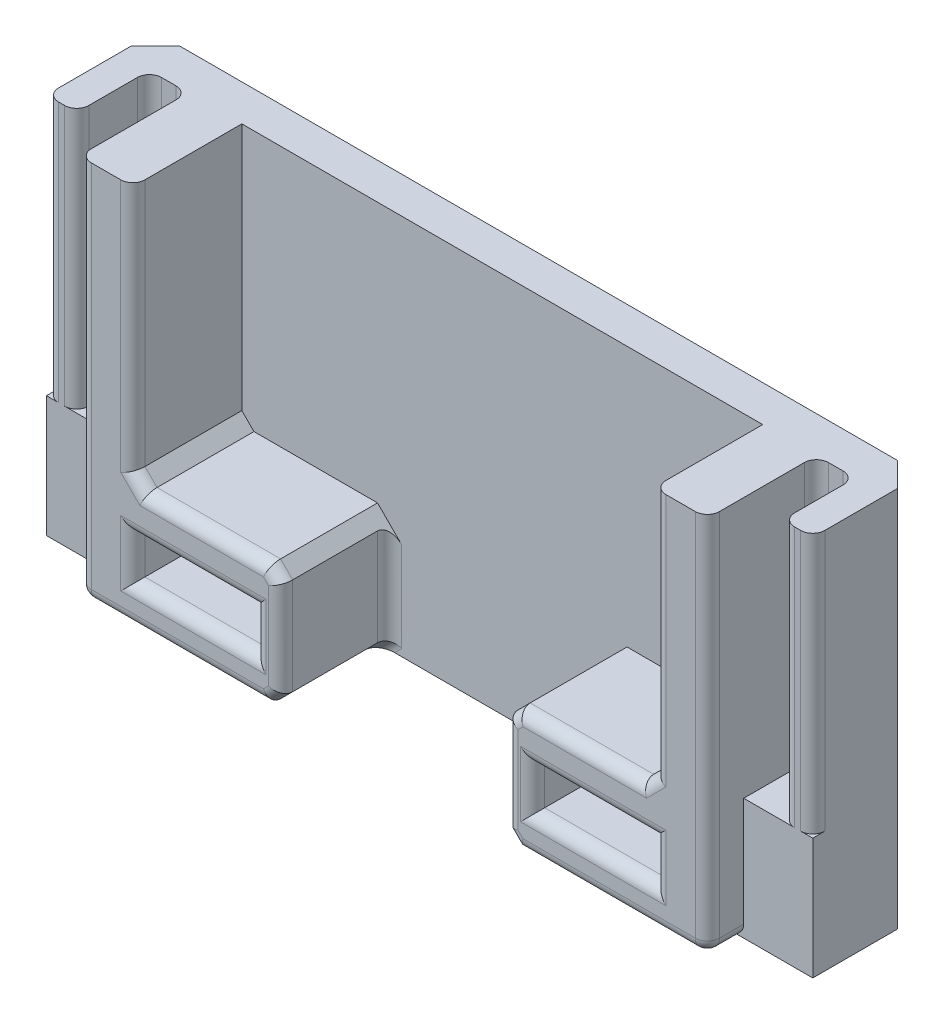
from build123d import *

# Parameters (mm, degrees)
BOSS_EXTRU_2_DEPTH      = 9
ESQUISSE3_W             = 51.8612703
ESQUISSE3_H             = 63
BOSS_EXTRU_3_DEPTH      = 3
ESQUISSE4_W             = 10
ESQUISSE4_H             = 3.4
ENL_V_MAT_EXTRU_1_DEPTH = 7
ESQUISSE5_W             = 3.2
ESQUISSE5_H             = 3
BOSS_EXTRU_4_DEPTH      = 63
CHANFREIN1_SIZE         = 1
CHANFREIN2_SIZE         = 2
CONG_1_R                = 1
CONG_2_R                = 1
CHANFREIN4_SIZE         = 1
CONG_4_R                = 1
CONG_5_R                = 1
ESQUISSE6_W             = 6.7
ESQUISSE6_H             = 1
BOSS_EXTRU_5_DEPTH      = 10
ESQUISSE7_W             = 25.281431527
ESQUISSE7_H             = 35.175981147
ENL_V_MAT_EXTRU_2_DEPTH = 79


with BuildPart() as part:
    # Esquisse2 → Boss.-Extru.2 (new body)
    with BuildSketch(Plane.XY):
        Polygon((-9.3, -31.5), (-9.3, -21.5), (-21.5, -21.5), (-21.5, 21.5), (21.5, 21.5), (21.5, -21.5), (9.3, -21.5), (9.3, -31.5), (25.93063515, -31.5), (25.93063515, 31.5), (-25.93063515, 31.5), (-25.93063515, -31.5), align=None)
    extrude(amount=BOSS_EXTRU_2_DEPTH)

    # Esquisse3 → Boss.-Extru.3 (add)
    with BuildSketch(Plane(origin=(0, 0, 0), x_dir=(-1, 0, 0), z_dir=(0, 0, -1))):
        Rectangle(ESQUISSE3_W, ESQUISSE3_H)
    extrude(amount=BOSS_EXTRU_3_DEPTH)

    # Esquisse4 → Enlèv. mat.-Extru.1 (cut)
    with BuildSketch(Plane.XY.offset(9)):
        with Locations((-16.5, -26.695538472)):
            Rectangle(ESQUISSE4_W, ESQUISSE4_H)
        with Locations((16.5, -26.695538472)):
            Rectangle(ESQUISSE4_W, ESQUISSE4_H)
        with Locations((16.5, 26.695538472)):
            Rectangle(ESQUISSE4_W, ESQUISSE4_H)
        with Locations((-16.5, 26.695538472)):
            Rectangle(ESQUISSE4_W, ESQUISSE4_H)
    extrude(amount=-ENL_V_MAT_EXTRU_1_DEPTH, mode=Mode.SUBTRACT)

    # Esquisse5 → Boss.-Extru.4 (add)
    with BuildSketch(Plane(origin=(0, 31.5, 0), x_dir=(1, 0, 0), z_dir=(0, 1, 0))):
        Polygon((-29.13063515, 0), (-29.13063515, 3), (-31.63063515, 3), (-31.63063515, -6), (-29.13063515, -6), align=None)
        with Locations((-27.53063515, 1.5)):
            Rectangle(ESQUISSE5_W, ESQUISSE5_H)
        with Locations((27.53063515, 1.5)):
            Rectangle(ESQUISSE5_W, ESQUISSE5_H)
        Polygon((29.13063515, 3), (29.13063515, 0), (29.13063515, -6), (31.63063515, -6), (31.63063515, 3), align=None)
    extrude(amount=-BOSS_EXTRU_4_DEPTH)

    # Chanfrein1
    chanfrein1_edges = [part.edges().sort_by_distance(p)[0] for p in [
        (21.5, -21.5, 4.5),
        (21.5, 21.5, 4.5),
        (-21.5, 21.5, 4.5),
        (-21.5, -21.5, 4.5),
    ]]
    chamfer(chanfrein1_edges, length=CHANFREIN1_SIZE)

    # Chanfrein2
    chanfrein2_edges = [part.edges().sort_by_distance(p)[0] for p in [
        (-31.63063515, 0, -3),
        (31.63063515, 0, -3),
        (0, -31.5, -3),
        (0, 31.5, -3),
    ]]
    chamfer(chanfrein2_edges, length=CHANFREIN2_SIZE)

    # Congé1
    cong_1_edges = [part.edges().sort_by_distance(p)[0] for p in [
        (-25.93063515, 0, 0),
        (-29.13063515, 0, 0),
        (-29.13063515, 0, 6),
        (-31.63063515, 0, 6),
        (25.93063515, 0, 0),
        (29.13063515, 0, 0),
        (29.13063515, 0, 6),
        (31.63063515, 0, 6),
    ]]
    fillet(cong_1_edges, radius=CONG_1_R)

    # Congé2
    cong_2_edges = [part.edges().sort_by_distance(p)[0] for p in [
        (-31.63063515, 31.5, 2),
        (31.63063515, 31.5, 2),
        (30.38063515, -31.5, 6),
        (30.38063515, 31.5, 6),
        (-30.38063515, 31.5, 6),
        (-29.13063515, 31.5, 3),
        (-27.53063515, 31.5, 0),
        (27.53063515, 31.5, 0),
        (29.13063515, 31.5, 3),
        (-31.337741931, 31.5, 5.707106781),
        (-29.423528369, 31.5, 5.707106781),
        (29.423528369, 31.5, 5.707106781),
        (31.337741931, 31.5, 5.707106781),
        (31.63063515, -31.5, 2),
        (-31.63063515, -31.5, 2),
        (29.13063515, -31.5, 3),
        (27.53063515, -31.5, 0),
        (-27.53063515, -31.5, 0),
        (-29.13063515, -31.5, 3),
        (-30.38063515, -31.5, 6),
        (-31.337741931, -31.5, 5.707106781),
        (-29.423528369, -31.5, 5.707106781),
        (29.423528369, -31.5, 5.707106781),
        (31.337741931, -31.5, 5.707106781),
        (28.837741931, 31.5, 0.292893219),
        (28.837741931, -31.5, 0.292893219),
        (26.223528369, 31.5, 0.292893219),
        (26.223528369, -31.5, 0.292893219),
        (-28.837741931, 31.5, 0.292893219),
        (-28.837741931, -31.5, 0.292893219),
        (-26.223528369, 31.5, 0.292893219),
        (-26.223528369, -31.5, 0.292893219),
        (-25.93063515, -31.5, 5),
        (-25.93063515, 31.5, 5),
        (25.93063515, 31.5, 5),
        (25.93063515, -31.5, 5),
    ]]
    fillet(cong_2_edges, radius=CONG_2_R - 0.0001)  # a hair under: the kernel refuses the full size

    # Chanfrein4
    chanfrein4_edges = [part.edges().sort_by_distance(p)[0] for p in [
        (-9.3, -31.5, 4.5),
        (9.3, -31.5, 4.5),
        (9.3, -21.5, 4.5),
        (-9.3, -21.5, 4.5),
    ]]
    chamfer(chanfrein4_edges, length=CHANFREIN4_SIZE)

    # Congé4
    cong_4_edges = [part.edges().sort_by_distance(p)[0] for p in [
        (-21.5, 0, 9),
        (-15.4, -21.5, 9),
        (21.5, 0, 9),
        (0, 21.5, 9),
        (-21, -21, 9),
        (21, -21, 9),
        (21, 21, 9),
        (-21, 21, 9),
        (0, 31.5, 9),
        (-17.615367575, -31.5, 9),
        (-25.93063515, 0, 9),
        (25.93063515, 0, 9),
        (25.63777122, 31.207136071, 9),
        (25.63777122, -31.207136071, 9),
        (-25.63777122, -31.207136071, 9),
        (-25.63777122, 31.207136071, 9),
        (17.615367575, -31.5, 9),
        (9.3, -26.5, 9),
        (-9.3, -26.5, 9),
        (15.4, -21.5, 9),
        (-9.8, -22, 9),
        (9.8, -22, 9),
        (-9.8, -31, 9),
        (9.8, -31, 9),
        (-16.5, 28.395538472, 9),
        (-11.5, 26.695538472, 9),
        (-21.5, 26.695538472, 9),
        (-16.5, 24.995538472, 9),
        (21.5, 26.695538472, 9),
        (16.5, 24.995538472, 9),
        (16.5, 28.395538472, 9),
        (11.5, 26.695538472, 9),
        (16.5, -28.395538472, 9),
        (11.5, -26.695538472, 9),
        (21.5, -26.695538472, 9),
        (16.5, -24.995538472, 9),
        (-21.5, -26.695538472, 9),
        (-16.5, -24.995538472, 9),
        (-16.5, -28.395538472, 9),
        (-11.5, -26.695538472, 9),
    ]]
    fillet(cong_4_edges, radius=CONG_4_R - 0.0001)  # a hair under: the kernel refuses the full size

    # Congé5
    cong_5_edges = [part.edges().sort_by_distance(p)[0] for p in [
        (9.3, -26.5, 0),
        (-9.3, -26.5, 0),
        (9.8, -31, 0),
        (-9.8, -31, 0),
    ]]
    fillet(cong_5_edges, radius=CONG_5_R)

    # Esquisse6 → Boss.-Extru.5 (add)
    with BuildSketch(Plane.XZ.offset(31.5)):
        with BuildLine():
            Line((-24.93063515, 1), (-24.93063515, 5))
            Line((-24.93063515, 5), (-31.63063515, 5))
            Line((-31.63063515, 5), (-31.63063515, -1))
            Line((-31.63063515, -1), (-26.93063515, -1))
            ThreePointArc((-26.93063515, -1), (-25.516421587, -0.414213562), (-24.93063515, 1))
        make_face()
        with Locations((-28.28063515, 5.5)):
            Rectangle(ESQUISSE6_W, ESQUISSE6_H)
        with BuildLine():
            Line((31.63063515, -1), (31.63063515, 5))
            Line((31.63063515, 5), (24.93063515, 5))
            Line((24.93063515, 5), (24.93063515, 1))
            ThreePointArc((24.93063515, 1), (25.516421587, -0.414213562), (26.93063515, -1))
            Line((26.93063515, -1), (31.63063515, -1))
        make_face()
        with Locations((28.28063515, 5.5)):
            Rectangle(ESQUISSE6_W, ESQUISSE6_H)
    extrude(amount=-BOSS_EXTRU_5_DEPTH)

    # Esquisse7 → Enlèv. mat.-Extru.2 (cut)
    with BuildSketch(Plane(origin=(31.63063515, 0, 0), x_dir=(0, 0, -1), z_dir=(1, 0, 0))):
        with Locations((3.640715764, 17.587990574)):
            Rectangle(ESQUISSE7_W, ESQUISSE7_H)
    extrude(amount=-ENL_V_MAT_EXTRU_2_DEPTH, mode=Mode.SUBTRACT)


solid = part.part
